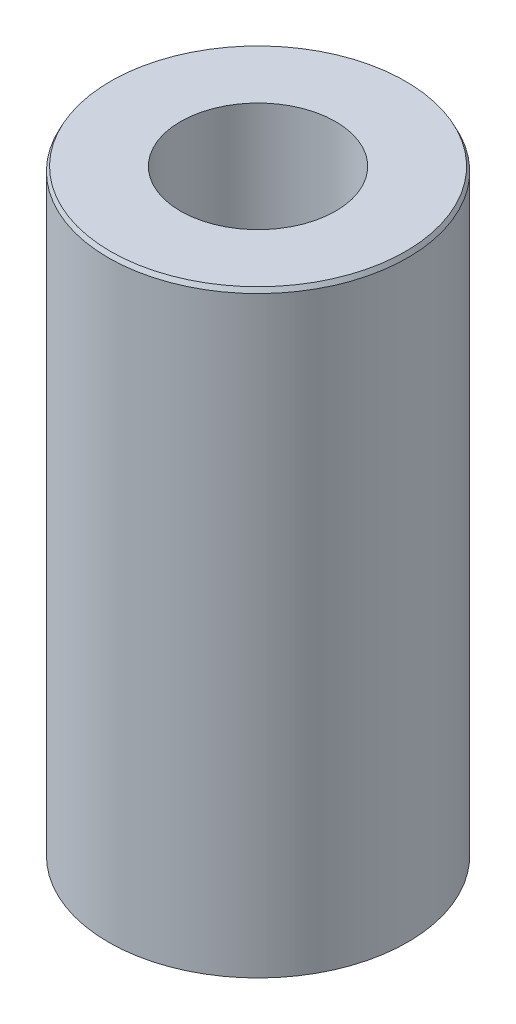
from build123d import *
from OCP.BRepFilletAPI import BRepFilletAPI_MakeChamfer

# Parameters (mm, degrees)
SKETCH1_R           = 17.5
BOSS_EXTRUDE1_DEPTH = 70.069123585
SKETCH2_R           = 9.071815203
CUT_EXTRUDE1_DEPTH  = 75.311385938
CHAMFER1_SIZE       = 0.511149713
CHAMFER1_SIZE2      = 0.258746377


with BuildPart() as part:
    # Sketch1 → Boss-Extrude1 (new body)
    with BuildSketch(Plane(origin=(0, 0, 0), x_dir=(1, 0, 0), z_dir=(0, 1, 0))):
        Circle(SKETCH1_R)
    extrude(amount=BOSS_EXTRUDE1_DEPTH)

    # Sketch2 → Cut-Extrude1 (cut, through all)
    with BuildSketch(Plane(origin=(0, 0, 0), x_dir=(1, 0, 0), z_dir=(0, 1, 0))):
        Circle(SKETCH2_R)
    extrude(amount=CUT_EXTRUDE1_DEPTH, mode=Mode.SUBTRACT)

    # Chamfer1: one chamfer whose edges measure the first distance from different faces: ONE call of the kernel's chamfer builder (chamfer() names one face for all edges)
    chamfer1_edges_1 = [part.edges().sort_by_distance(p)[0] for p in [
        (-17.5, 70.069123585, 0),
    ]]
    chamfer1_side_1 = [part.faces().sort_by_distance(p)[0] for p in [
        (-17.5, 35.034561793, 0),
    ]]
    chamfer1_edges_2 = [part.edges().sort_by_distance(p)[0] for p in [
        (-17.5, 0, 0),
    ]]
    chamfer1_side_2 = [part.faces().sort_by_distance(p)[0] for p in [
        (-17.005025253, 0, 0),
    ]]
    chamfer1 = BRepFilletAPI_MakeChamfer(part.part.solid().wrapped)
    for e in chamfer1_edges_1:
        chamfer1.Add(CHAMFER1_SIZE, CHAMFER1_SIZE2, e.wrapped, chamfer1_side_1[0].wrapped)  # the first distance lies on this face
    for e in chamfer1_edges_2:
        chamfer1.Add(CHAMFER1_SIZE, CHAMFER1_SIZE2, e.wrapped, chamfer1_side_2[0].wrapped)  # the first distance lies on this face
    add(Compound.cast(chamfer1.Shape()), mode=Mode.REPLACE)


solid = part.part
